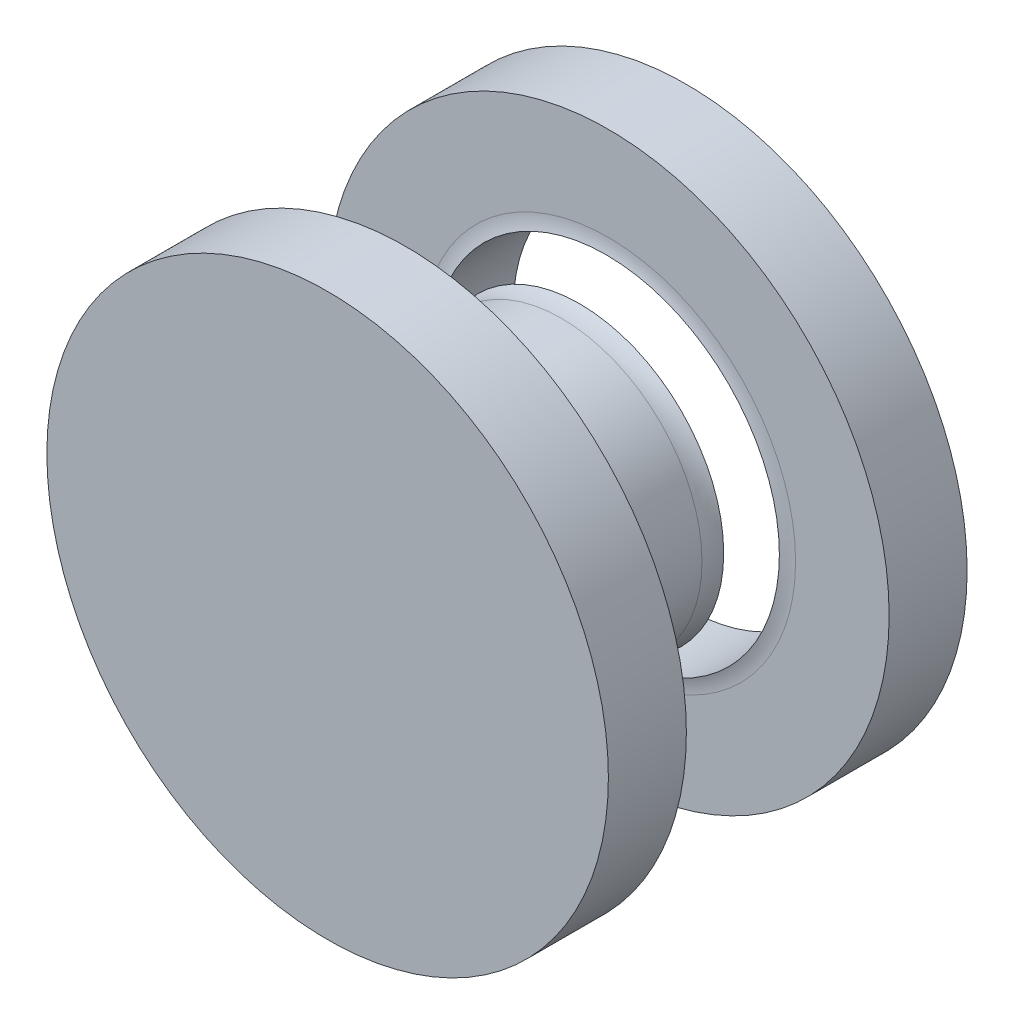
from build123d import *

# Parameters (mm, degrees)
SKETCH1_R           = 18
BOSS_EXTRUDE1_DEPTH = 5
SKETCH3_R           = 9
BOSS_EXTRUDE2_DEPTH = 6.5
FILLET8_R           = 3
SKETCH9_R           = 11.1
CUT_EXTRUDE6_DEPTH  = 6.84


with BuildPart() as part:
    # Sketch1 → Boss-Extrude1 (new body)
    with BuildSketch(Plane(origin=(0, 0, 0), x_dir=(0, 1, 0), z_dir=(0, 0, 1))):
        Circle(SKETCH1_R)
    extrude(amount=BOSS_EXTRUDE1_DEPTH)

    # Sketch3 → Boss-Extrude2 (add)
    with BuildSketch(Plane.XY.offset(5)):
        Circle(SKETCH3_R)
    extrude(amount=BOSS_EXTRUDE2_DEPTH)

    # Fillet8
    fillet8_edges = [part.edges().sort_by_distance(p)[0] for p in [
        (-9, 0, 5),
    ]]
    fillet(fillet8_edges, radius=FILLET8_R)

    # Mirror2: part across plane


with BuildPart() as part_1:
    add(part.part)
    add(part.part.mirror(Plane.XY.offset(11.5)))

    # Sketch9 → Cut-Extrude6 (cut)
    with BuildSketch(Plane(origin=(0, 0, 0), x_dir=(1, 0, 0), z_dir=(0, 0, -1))):
        Circle(SKETCH9_R)
    extrude(amount=-CUT_EXTRUDE6_DEPTH, mode=Mode.SUBTRACT)


with BuildPart() as cut_extrude6_piece_1:
    # of the separate pieces the step leaves, piece 1, a body of its own (cut_extrude6_pieces)
    add(part_1.part.solids().sort_by_distance((9.233341365, 0, 6.84))[0])


with BuildPart() as cut_extrude6_piece_2:
    # of the separate pieces the step leaves, piece 2, a body of its own (cut_extrude6_pieces)
    add(part_1.part.solids().sort_by_distance((12, 0, 5))[0])


solid = Compound([cut_extrude6_piece_1.part, cut_extrude6_piece_2.part])
